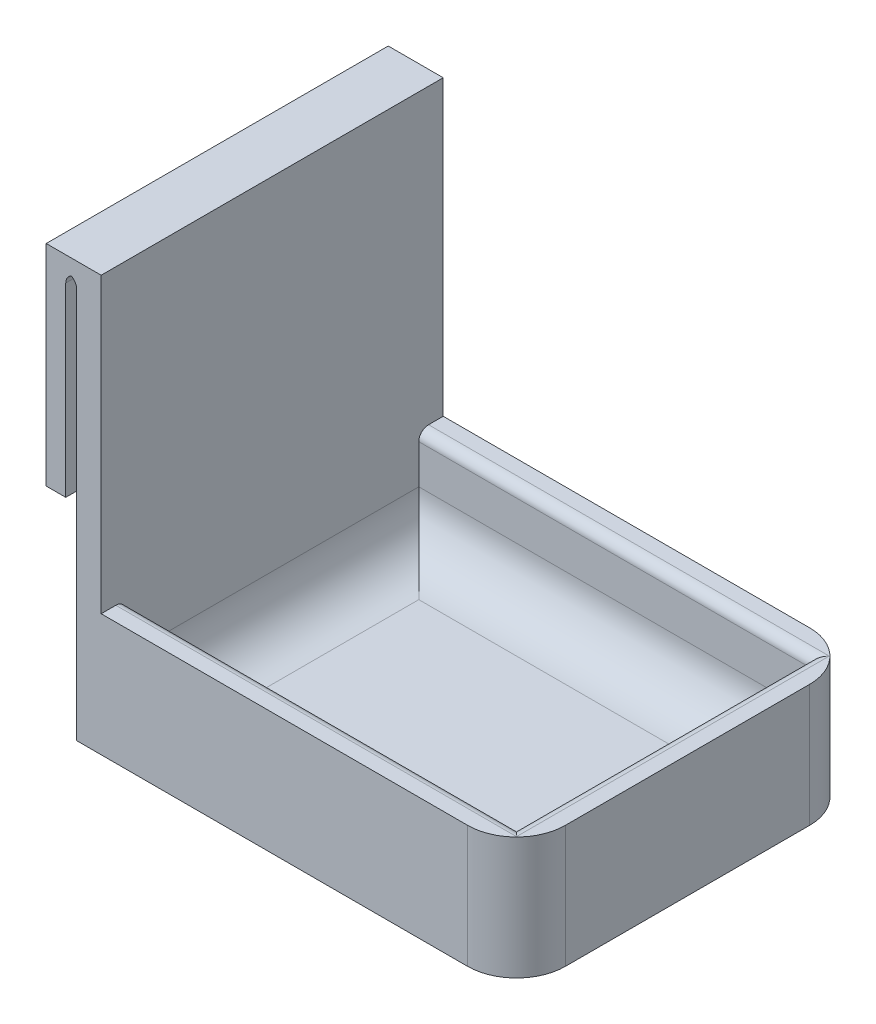
from build123d import *

# Parameters (mm, degrees)
SKETCH1_W           = 90
SKETCH1_H           = 70
BOSS_EXTRUDE1_DEPTH = 5
SKETCH2_W           = 90
SKETCH2_H           = 70
SKETCH2_W_2         = 80
SKETCH2_H_2         = 60
BOSS_EXTRUDE2_DEPTH = 80
SKETCH3_W           = 70
SKETCH3_H           = 3
BOSS_EXTRUDE4_DEPTH = 6.25
SKETCH4_W           = 4
SKETCH4_H           = 70
BOSS_EXTRUDE5_DEPTH = 40
SKETCH5_W           = 70
SKETCH5_H           = 60
CUT_EXTRUDE3_DEPTH  = 85
FILLET1_R           = 10
FILLET2_R           = 2
FILLET3_R           = 2
FILLET4_R           = 10


with BuildPart() as part:
    # Sketch1 → Boss-Extrude1 (new body)
    with BuildSketch(Plane(origin=(0, 0, 0), x_dir=(1, 0, 0), z_dir=(0, 1, 0))):
        with Locations((45, -35)):
            Rectangle(SKETCH1_W, SKETCH1_H)
    extrude(amount=BOSS_EXTRUDE1_DEPTH)

    # Sketch2 → Boss-Extrude2 (add)
    with BuildSketch(Plane(origin=(0, 5, 0), x_dir=(1, 0, 0), z_dir=(0, 1, 0))):
        with Locations((45, -35)):
            Rectangle(SKETCH2_W, SKETCH2_H)
        with Locations((45, -35)):
            Rectangle(SKETCH2_W_2, SKETCH2_H_2, mode=Mode.SUBTRACT)
    extrude(amount=BOSS_EXTRUDE2_DEPTH)

    # Sketch3 → Boss-Extrude4 (add)
    with BuildSketch(Plane.ZY):
        with Locations((35, 83.5)):
            Rectangle(SKETCH3_W, SKETCH3_H)
    extrude(amount=BOSS_EXTRUDE4_DEPTH)

    # Sketch4 → Boss-Extrude5 (add)
    with BuildSketch(Plane.XZ.offset(-82)):
        with Locations((-4.25, 35)):
            Rectangle(SKETCH4_W, SKETCH4_H)
    extrude(amount=BOSS_EXTRUDE5_DEPTH)

    # Sketch5 → Cut-Extrude3 (cut)
    with BuildSketch(Plane(origin=(90, 0, 0), x_dir=(0, 0, -1), z_dir=(1, 0, 0))):
        with Locations((-35, 55)):
            Rectangle(SKETCH5_W, SKETCH5_H)
    extrude(amount=-CUT_EXTRUDE3_DEPTH, mode=Mode.SUBTRACT)

    # Fillet1
    fillet1_edges = [part.edges().sort_by_distance(p)[0] for p in [
        (5, 5, 35),
        (45, 5, 65),
        (85, 5, 35),
        (45, 5, 5),
    ]]
    fillet(fillet1_edges, radius=FILLET1_R)

    # Fillet2
    # the kernel refuses this fillet: 2 mm, written as the material it adds along each edge
    with BuildSketch(Plane(origin=(0, 82, 70), x_dir=(-1, 0, 0), z_dir=(0, 0, -1)), Plane(origin=(-2.25, 82, 70), x_dir=(0, -1, 0), z_dir=(0, 0, -1))) as fillet2_piece_1:
        with BuildLine():
            CenterArc((FILLET2_R, -FILLET2_R), FILLET2_R, 90, 90)
            Line((0, -FILLET2_R), (0, 0))
            Line((0, 0), (FILLET2_R, 0))
        make_face()
    extrude(amount=70)

    # Fillet3
    fillet3_edges = [part.edges().sort_by_distance(p)[0] for p in [
        (45, 25, 5),
        (85, 25, 35),
        (45, 25, 65),
    ]]
    fillet(fillet3_edges, radius=FILLET3_R)

    # Fillet4
    fillet4_edges = [part.edges().sort_by_distance(p)[0] for p in [
        (90, 12.5, 0),
        (90, 12.5, 70),
    ]]
    fillet(fillet4_edges, radius=FILLET4_R)


solid = part.part
